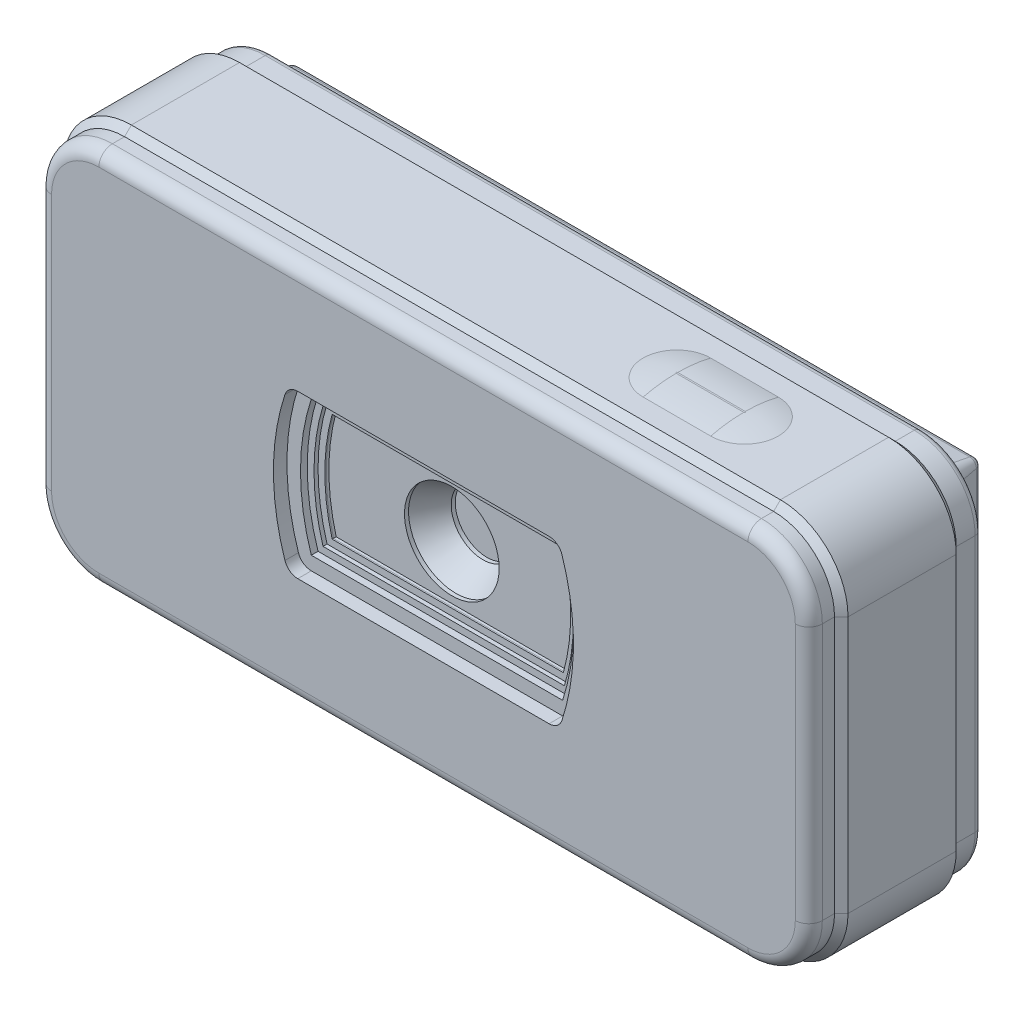
from build123d import *

# Parameters (mm, degrees)
SKETCH_1_W          = 58
SKETCH_1_H          = 29
EXTRUDE_1_DEPTH     = 9
FILLET_1_R          = 5
CHAMFER_1_SIZE      = 0.5
EXTRUDE_2_DEPTH     = 1.9
FILLET_2_R          = 1
EXTRUDE_3_DEPTH     = 1.9
FILLET_3_R          = 0.5
EXTRUDE_4_DEPTH     = 3
EXTRUDE_4_TAPER     = 11.000000000000002
FILLET_4_R          = 0.5
CUT_EXTRUDE_1_DEPTH = 1
CUT_EXTRUDE_2_DEPTH = 0.5
CUT_EXTRUDE_3_DEPTH = 0.3
CUT_EXTRUDE_4_DEPTH = 0.3
SKETCH_9_R          = 3.5
CUT_EXTRUDE_5_DEPTH = 0.3
SKETCH_10_R         = 3.5
CUT_EXTRUDE_6_DEPTH = 2
CUT_EXTRUDE_6_DRAFT = -30.000000000000068
SKETCH_11_R         = 2.345299461620746
CUT_EXTRUDE_7_DEPTH = 0.3
EXTRUDE_5_DEPTH     = 0.3
FILLET_5_R          = 10.1


with BuildPart() as part:
    # 스케치1 → 보스-돌출1 (new body)
    with BuildSketch(Plane.XY):
        Rectangle(SKETCH_1_W, SKETCH_1_H)
    extrude(amount=EXTRUDE_1_DEPTH)

    # 필렛1
    fillet_1_edges = [part.edges().sort_by_distance(p)[0] for p in [
        (29.00000000000001, -14.499999999999998, 4.5),
        (-28.999999999999986, -14.499999999999998, 4.5),
        (-28.999999999999986, 14.500000000000002, 4.5),
        (29.00000000000001, 14.500000000000002, 4.5),
    ]]
    fillet(fillet_1_edges, radius=FILLET_1_R)

    # 모따기1
    chamfer_1_edges = [part.edges().sort_by_distance(p)[0] for p in [
        (1.421e-14, -14.499999999999998, 0),
        (1.421e-14, -14.499999999999998, 9),
        (29.00000000000001, 0, 0),
        (-28.999999999999986, 3.55e-15, 0),
        (1.066e-14, 14.500000000000002, 0),
        (-27.535533905932724, 13.035533905932741, 0),
        (27.53553390593275, 13.035533905932741, 0),
        (27.535533905932752, -13.035533905932738, 0),
        (-27.535533905932724, -13.035533905932738, 0),
        (-28.999999999999986, 3.55e-15, 9),
        (29.00000000000001, 0, 9),
        (1.066e-14, 14.500000000000002, 9),
        (-27.535533905932724, 13.035533905932741, 9),
        (27.53553390593275, 13.035533905932741, 9),
        (27.535533905932752, -13.035533905932738, 9),
        (-27.535533905932724, -13.035533905932738, 9),
    ]]
    chamfer(chamfer_1_edges, length=CHAMFER_1_SIZE)


with BuildPart() as body_2:
    # 스케치2 → 보스-돌출2 (new body)
    with BuildSketch(Plane.XY.offset(9)):
        with BuildLine():
            Line((24.000000000000007, 14.000000000000009), (-23.999999999999982, 14.000000000000009))
            ThreePointArc((-23.999999999999982, 14.000000000000009), (-27.18198051533945, 12.681980515339472), (-28.49999999999999, 9.500000000000002))
            Line((-28.49999999999999, 9.500000000000002), (-28.49999999999999, -9.499999999999998))
            ThreePointArc((-28.49999999999999, -9.499999999999998), (-27.18198051533945, -12.681980515339466), (-23.999999999999982, -14.000000000000005))
            Line((-23.999999999999982, -14.000000000000005), (24.000000000000007, -14.000000000000005))
            ThreePointArc((24.000000000000007, -14.000000000000005), (27.18198051533948, -12.681980515339468), (28.500000000000018, -9.499999999999998))
            Line((28.500000000000018, -9.499999999999998), (28.500000000000018, 9.500000000000002))
            ThreePointArc((28.500000000000018, 9.500000000000002), (27.18198051533948, 12.681980515339472), (24.000000000000007, 14.000000000000009))
        make_face()
    extrude(amount=EXTRUDE_2_DEPTH)

    # 필렛2
    fillet_2_edges = [body_2.edges().sort_by_distance(p)[0] for p in [
        (-27.18198051533945, 12.681980515339472, 10.9),
        (-28.49999999999999, 1.78e-15, 10.9),
        (-27.18198051533945, -12.681980515339466, 10.9),
        (1.066e-14, -14.000000000000005, 10.9),
        (27.18198051533948, -12.681980515339468, 10.9),
        (28.500000000000018, 1.78e-15, 10.9),
        (27.18198051533948, 12.681980515339472, 10.9),
        (1.421e-14, 14.000000000000009, 10.9),
    ]]
    fillet(fillet_2_edges, radius=FILLET_2_R)

    # 스케치5 → 컷-돌출1 (cut)
    with BuildSketch(Plane.XY.offset(10.9)):
        with BuildLine():
            Line((-9.292223801942907, -6), (9.292223801942903, -6))
            ThreePointArc((9.292223801942903, -6), (9.878778053424123, -5.809909939480499), (10.242336038581271, -5.311908220138612))
            ThreePointArc((10.242336038581271, -5.311908220138612), (11.091942439359082, 0), (10.242336038581271, 5.311908220138612))
            ThreePointArc((10.242336038581271, 5.311908220138612), (9.878778053424123, 5.809909939480499), (9.292223801942903, 6))
            Line((9.292223801942903, 6), (-9.292223801942907, 6))
            ThreePointArc((-9.292223801942907, 6), (-9.878778053424126, 5.809909939480499), (-10.242336038581275, 5.311908220138612))
            ThreePointArc((-10.242336038581275, 5.311908220138612), (-11.091942439359089, -2.09e-15), (-10.242336038581275, -5.311908220138612))
            ThreePointArc((-10.242336038581275, -5.311908220138612), (-9.878778053424126, -5.8099099394805), (-9.292223801942907, -6))
        make_face()
    extrude(amount=-CUT_EXTRUDE_1_DEPTH, mode=Mode.SUBTRACT)

    # 스케치6 → 컷-돌출2 (cut)
    with BuildSketch(Plane.XY.offset(9.899999999999999)):
        with BuildLine():
            Line((9.292223801942903, 5), (-9.292223801942907, 5))
            ThreePointArc((-9.292223801942907, 5), (-10.091942439359086, 1.96e-15), (-9.292223801942907, -4.999999999999998))
            Line((-9.292223801942907, -4.999999999999998), (9.292223801942903, -5))
            ThreePointArc((9.292223801942903, -5), (10.091942439359086, -1.78e-15), (9.292223801942903, 5))
        make_face()
    extrude(amount=-CUT_EXTRUDE_2_DEPTH, mode=Mode.SUBTRACT)

    # 스케치7 → 컷-돌출3 (cut)
    with BuildSketch(Plane.XY.offset(9.399999999999999)):
        with BuildLine():
            Line((8.92570290507378, 4.500000000000001), (-8.925702905073786, 4.500000000000001))
            ThreePointArc((-8.925702905073786, 4.500000000000001), (-9.591942439359087, 1.9e-15), (-8.92570290507379, -4.499999999999992))
            Line((-8.92570290507379, -4.499999999999992), (8.925702905073784, -4.499999999999992))
            ThreePointArc((8.925702905073784, -4.499999999999992), (9.591942439359084, 4.31e-15), (8.92570290507378, 4.500000000000001))
        make_face()
    extrude(amount=-CUT_EXTRUDE_3_DEPTH, mode=Mode.SUBTRACT)


with BuildPart() as body_3:
    # 스케치3 → 보스-돌출3 (new body)
    with BuildSketch(Plane(origin=(0, 0, 0), x_dir=(-1, 0, 0), z_dir=(0, 0, -1))):
        with BuildLine():
            Line((-28.500000000000007, 9.500000000000002), (-28.50000000000001, -9.499999999999998))
            ThreePointArc((-28.50000000000001, -9.499999999999998), (-27.181980515339475, -12.681980515339463), (-24.000000000000007, -13.999999999999998))
            Line((-24.000000000000007, -13.999999999999998), (23.999999999999982, -13.999999999999998))
            ThreePointArc((23.999999999999982, -13.999999999999998), (27.181980515339447, -12.681980515339461), (28.499999999999982, -9.499999999999998))
            Line((28.499999999999982, -9.499999999999998), (28.499999999999982, 9.500000000000002))
            ThreePointArc((28.499999999999982, 9.500000000000002), (27.181980515339447, 12.681980515339465), (23.999999999999982, 14.000000000000002))
            Line((23.999999999999982, 14.000000000000002), (-24.000000000000007, 14.000000000000002))
            ThreePointArc((-24.000000000000007, 14.000000000000002), (-27.181980515339472, 12.681980515339466), (-28.500000000000007, 9.500000000000002))
        make_face()
    extrude(amount=EXTRUDE_3_DEPTH)

    # 필렛3
    fillet_3_edges = [body_3.edges().sort_by_distance(p)[0] for p in [
        (27.181980515339475, -12.681980515339465, -1.9),
        (1.421e-14, -13.999999999999998, -1.9),
        (-27.181980515339447, -12.681980515339463, -1.9),
        (-28.499999999999982, 1.78e-15, -1.9),
        (-27.181980515339447, 12.681980515339466, -1.9),
        (1.066e-14, 14.000000000000002, -1.9),
        (27.181980515339472, 12.681980515339466, -1.9),
        (28.500000000000007, 1.78e-15, -1.9),
    ]]
    fillet(fillet_3_edges, radius=FILLET_3_R)

    # 스케치4 → 보스-돌출4 (add)
    with BuildSketch(Plane(origin=(0, 0, -1.9), x_dir=(-1, 0, 0), z_dir=(0, 0, -1))):
        with BuildLine():
            Line((-24.99999999999999, -11.75), (24.99999999999999, -11.75))
            ThreePointArc((24.99999999999999, -11.75), (25.707106781186543, -11.457106781186548), (26, -10.749999999999993))
            Line((26, -10.749999999999993), (26, 10.749999999999993))
            ThreePointArc((26, 10.749999999999993), (25.707106781186543, 11.457106781186548), (24.99999999999999, 11.75))
            Line((24.99999999999999, 11.75), (-24.99999999999999, 11.75))
            ThreePointArc((-24.99999999999999, 11.75), (-25.707106781186546, 11.45710678118655), (-26, 10.749999999999993))
            Line((-26, 10.749999999999993), (-26, -10.749999999999993))
            ThreePointArc((-26, -10.749999999999993), (-25.707106781186543, -11.457106781186548), (-24.99999999999999, -11.75))
        make_face()
    extrude(amount=EXTRUDE_4_DEPTH, taper=EXTRUDE_4_TAPER)

    # 필렛4
    fillet_4_edges = [body_3.edges().sort_by_distance(p)[0] for p in [
        (-25.29476387702529, 11.044763877025291, -4.9),
        (7.24e-15, 11.166859072586844, -4.9),
        (25.294763877025293, 11.044763877025293, -4.9),
        (25.416859072586846, 5.28e-15, -4.9),
        (25.29476387702529, -11.044763877025291, -4.9),
        (1.4e-16, -11.166859072586844, -4.9),
        (-25.29476387702529, -11.044763877025291, -4.9),
        (-25.416859072586846, -5e-17, -4.9),
    ]]
    fillet(fillet_4_edges, radius=FILLET_4_R)


with BuildPart() as cut_extrude_4_tool:
    # 스케치8 → 컷-돌출4 (new body)
    with BuildSketch(Plane.XY.offset(9.099999999999998)):
        with BuildLine():
            Line((8.549912849042506, 4), (-8.54991284904251, 4))
            ThreePointArc((-8.54991284904251, 4), (-9.091942439359086, 8.52e-15), (-8.549912849042514, -3.9999999999999916))
            Line((-8.549912849042514, -3.9999999999999916), (8.549912849042508, -3.9999999999999916))
            ThreePointArc((8.549912849042508, -3.9999999999999916), (9.091942439359082, 4.17e-15), (8.549912849042506, 4))
        make_face()
    extrude(amount=-CUT_EXTRUDE_4_DEPTH)


with BuildPart() as part_1:
    add(part.part)

    # 컷-돌출4: cut by cut_extrude_4_tool
    add(cut_extrude_4_tool.part, mode=Mode.SUBTRACT)

    # 스케치9 → 컷-돌출5 (cut)
    with BuildSketch(Plane.XY.offset(8.799999999999999)):
        Circle(SKETCH_9_R)
    extrude(amount=-CUT_EXTRUDE_5_DEPTH, mode=Mode.SUBTRACT)


with BuildPart() as body_2_1:
    add(body_2.part)

    # 컷-돌출4: cut by cut_extrude_4_tool
    add(cut_extrude_4_tool.part, mode=Mode.SUBTRACT)


with BuildPart() as cut_extrude_6_tool:
    # 스케치10 → 컷-돌출6 (with draft: the straight prism first)
    with BuildSketch(Plane.XY.offset(8.499999999999998)):
        Circle(SKETCH_10_R)
    extrude(amount=-CUT_EXTRUDE_6_DEPTH)
    # 컷-돌출6: the draft: its side faces are tilted about the plane it starts from
    cut_extrude_6_sides = [cut_extrude_6_tool.faces().sort_by_distance(p)[0] for p in [
        (-3.5, 0, 7.5),
    ]]
    draft(cut_extrude_6_sides, Plane.XY.offset(8.499999999999998), CUT_EXTRUDE_6_DRAFT)


with BuildPart() as part_2:
    add(part_1.part)

    # 컷-돌출6: cut by cut_extrude_6_tool
    add(cut_extrude_6_tool.part, mode=Mode.SUBTRACT)

    # 스케치11 → 컷-돌출7 (cut)
    with BuildSketch(Plane.XY.offset(6.499999999999999)):
        Circle(SKETCH_11_R)
    extrude(amount=-CUT_EXTRUDE_7_DEPTH, mode=Mode.SUBTRACT)

    # 스케치12 → 보스-돌출5 (add)
    with BuildSketch(Plane(origin=(0, 14.500000000000002, 0), x_dir=(1, 0, 0), z_dir=(0, 1, 0))):
        with BuildLine():
            Line((12.34706947778462, -1.9999999999999958), (17.347069477784625, -1.9999999999999958))
            ThreePointArc((17.347069477784625, -1.9999999999999958), (19.847069477784625, -4.4999999999999964), (17.347069477784625, -6.9999999999999964))
            Line((17.347069477784625, -6.9999999999999964), (12.34706947778462, -6.9999999999999964))
            ThreePointArc((12.34706947778462, -6.9999999999999964), (9.847069477784618, -4.4999999999999964), (12.34706947778462, -1.9999999999999958))
        make_face()
    extrude(amount=EXTRUDE_5_DEPTH)

    # 필렛5
    # the kernel refuses this fillet: 10.1 mm, written as the material it takes off along each edge
    with BuildSketch(Plane(origin=(12.34706947778462, 14.800000000000002, 1.9999999999999958), x_dir=(0, -1, -7.4e-16), z_dir=(1, 0, 0))) as fillet_5_piece_1:
        with BuildLine():
            CenterArc((10.099999999999998, -2.443358344574135), FILLET_5_R, 166.00030870158, 13.999691298419975)
            Line((-1.81e-15, -2.4433583445741274), (-0.20200000000000176, -2.4433583445741274))
            Line((-0.20200000000000176, -2.4433583445741274), (-0.20199999999999996, 1.5e-16))
            Line((-0.20199999999999996, 1.5e-16), (1.5e-16, 0.20199999999999996))
            ThreePointArc((1.5e-16, 0.20199999999999996), (0.1500000000000005, 0.20199999999999985), (0.10400000000000102, 0.04886716689148277))
            Line((0.10400000000000102, 0.04886716689148277), (0.3000000000000007, 0))
        make_face()
    extrude(amount=5.000000000000005, mode=Mode.SUBTRACT)
    with BuildSketch(Plane(origin=(17.347069477784625, 14.800000000000002, 6.9999999999999964), x_dir=(0, -1, 0), z_dir=(-1, 0, 0))) as fillet_5_piece_2:
        with BuildLine():
            CenterArc((10.1, -2.443358344574124), FILLET_5_R, 166.00030870158005, 13.999691298419947)
            Line((0, -2.443358344574124), (-0.20199999999999996, -2.443358344574124))
            Line((-0.20199999999999996, -2.443358344574124), (-0.20199999999999996, 0))
            Line((-0.20199999999999996, 0), (0, 0.20199999999999996))
            ThreePointArc((0, 0.20199999999999996), (0.15000000000000036, 0.20199999999999996), (0.10400000000000098, 0.04886716689148241))
            Line((0.10400000000000098, 0.04886716689148241), (0.3000000000000007, 0))
        make_face()
    extrude(amount=5.000000000000005, mode=Mode.SUBTRACT)
    with BuildSketch(Plane(origin=(17.347069477784625, 14.800000000000002, 4.4999999999999964), x_dir=(0, 0, -1), z_dir=(-1, 0, 0))) as fillet_5_piece_3:
        with BuildLine():
            CenterArc((0.05664165542587529, 10.1), FILLET_5_R, 270, 13.999691298419975)
            Line((0.05664165542587529, 0), (0.05664165542587529, -0.20199999999999996))
            Line((0.05664165542587529, -0.20199999999999996), (2.5000000000000004, -0.20199999999999996))
            Line((2.5000000000000004, -0.20199999999999996), (2.7020000000000004, 0))
            ThreePointArc((2.7020000000000004, 0), (2.7020000000000004, 0.15000000000000036), (2.548867166891483, 0.10400000000000098))
            Line((2.548867166891483, 0.10400000000000098), (2.5000000000000004, 0.3000000000000007))
        make_face()
    revolve(axis=Axis((17.347069477784625, 14.800000000000002, 4.4999999999999964), (0, -1, 0)), revolution_arc=180, mode=Mode.SUBTRACT)
    with BuildSketch(Plane(origin=(12.347069477784618, 14.800000000000002, 4.4999999999999964), x_dir=(7.1e-16, 0, 1), z_dir=(1, 0, -7.1e-16))) as fillet_5_piece_4:
        with BuildLine():
            CenterArc((0.0566416554258744, 10.1), FILLET_5_R, 270, 13.999691298419975)
            Line((0.0566416554258744, 0), (0.0566416554258744, -0.20199999999999996))
            Line((0.0566416554258744, -0.20199999999999996), (2.5, -0.20199999999999996))
            Line((2.5, -0.20199999999999996), (2.702, 0))
            ThreePointArc((2.702, 0), (2.702, 0.15000000000000036), (2.5488671668914824, 0.10400000000000098))
            Line((2.5488671668914824, 0.10400000000000098), (2.5, 0.3000000000000007))
        make_face()
    revolve(axis=Axis((12.347069477784618, 14.800000000000002, 4.4999999999999964), (0, -1, 0)), revolution_arc=180.00000000000009, mode=Mode.SUBTRACT)


solid = Compound([body_3.part, body_2_1.part, part_2.part])
